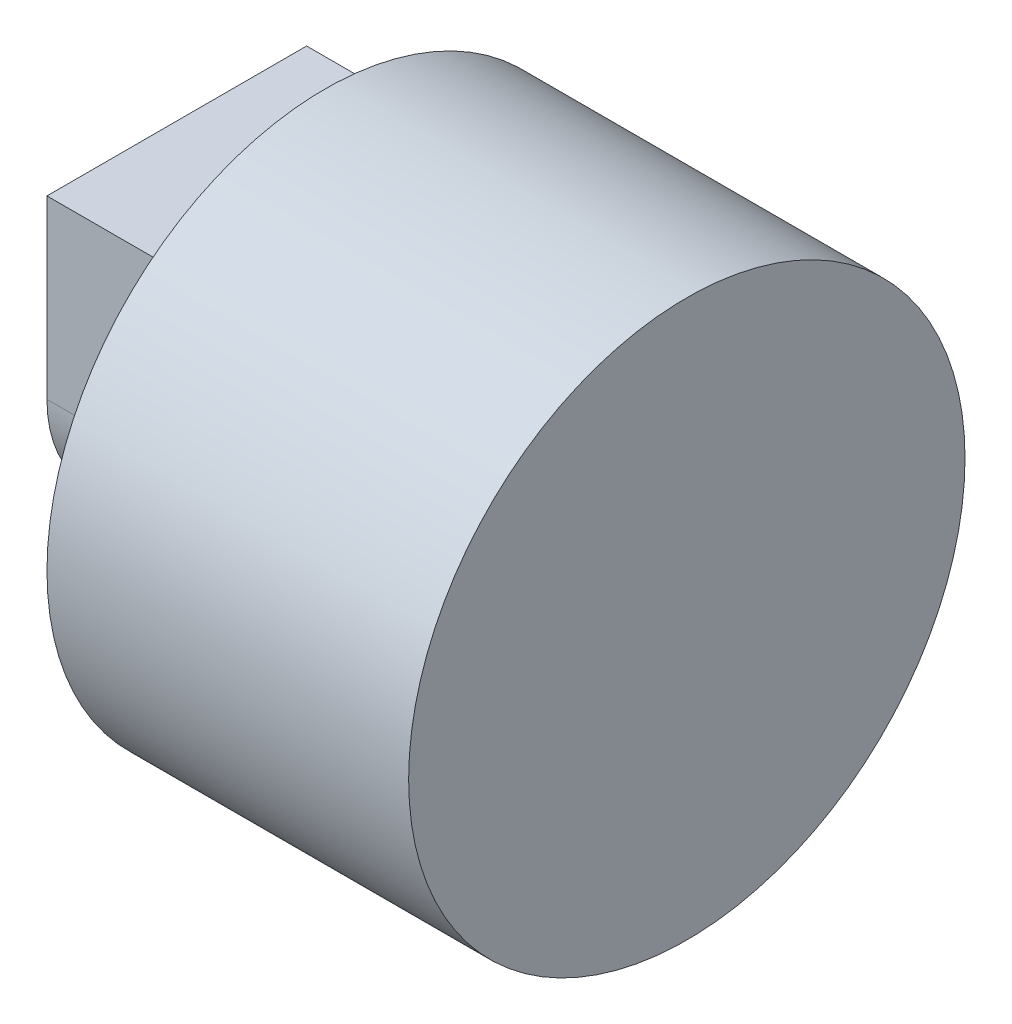
from build123d import *

# Parameters (mm, degrees)
SKETCH1_W           = 19.5
SKETCH1_H           = 15
BOSS_EXTRUDE1_DEPTH = 8
CUT_EXTRUDE1_START  = -10
SKETCH3_R           = 3
CUT_EXTRUDE1_DEPTH  = 10


with BuildPart() as part:
    # Sketch1 → Revolve1 (revolve)
    with BuildSketch(Plane.XY):
        with Locations((9.75, 7.5)):
            Rectangle(SKETCH1_W, SKETCH1_H)
    revolve(axis=Axis((0, 0, 0), (1, 0, 0)))

    # Sketch2 → Boss-Extrude1 (add)
    with BuildSketch(Plane.ZY):
        with BuildLine():
            Line((-7, 0), (-7, 9.5))
            Line((-7, 9.5), (7, 9.5))
            Line((7, 9.5), (7, 0))
            ThreePointArc((7, 0), (0, -7), (-7, 0))
        make_face()
        with BuildLine():
            Line((-3, 0), (-3, 5.5))
            Line((-3, 5.5), (3, 5.5))
            Line((3, 5.5), (3, 0))
            ThreePointArc((3, 0), (0, -3), (-3, 0))
        make_face(mode=Mode.SUBTRACT)
    extrude(amount=BOSS_EXTRUDE1_DEPTH)

    # Sketch3 → Cut-Extrude1 (cut)
    with BuildSketch(Plane.ZY.offset(CUT_EXTRUDE1_START)):
        Circle(SKETCH3_R)
    extrude(amount=CUT_EXTRUDE1_DEPTH, mode=Mode.SUBTRACT)


solid = part.part
